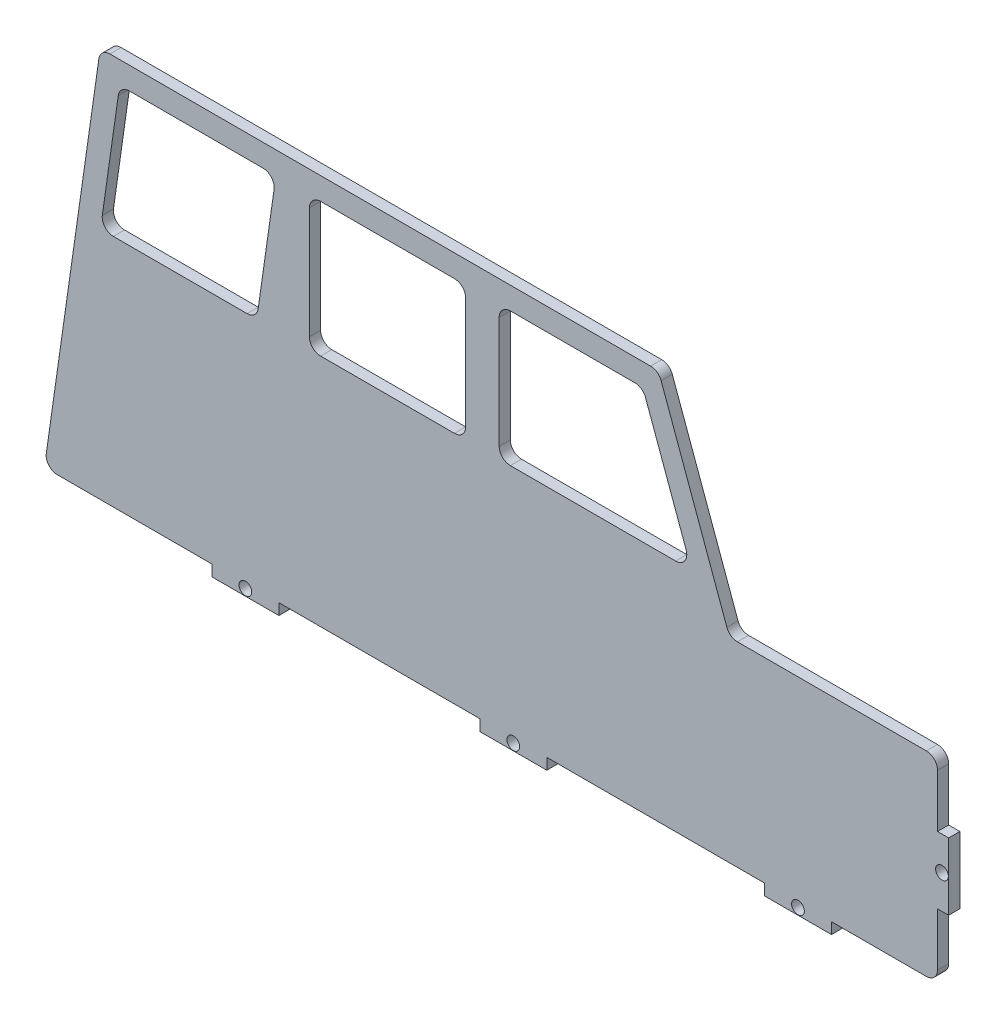
from build123d import *

# Parameters (mm, degrees)
BOSS_EXTRUDE1_DEPTH = 2.54
CUT_EXTRUDE1_REACH  = 139.823
SKETCH2_W           = 35.56
SKETCH2_H           = 30.48
FILLET1_R           = 2.54
FILLET3_R           = 2.54
CUT_EXTRUDE2_REACH  = 139.823
SKETCH4_R           = 1.4478


with BuildPart() as part:
    # Sketch1 → Boss-Extrude1 (new body)
    with BuildSketch(Plane.XY):
        Polygon((-63.5, 44.45), (63.5, 44.45), (79.678476913, 0), (127, 0), (127, -14.605), (129.54, -14.605), (129.54, -29.845), (127, -29.845), (127, -44.45), (102.87, -44.45), (102.87, -46.99), (87.63, -46.99), (87.63, -44.45), (63.5, -44.45), (38.1, -44.45), (38.1, -46.99), (22.86, -46.99), (22.86, -44.45), (-22.86, -44.45), (-22.86, -46.99), (-38.1, -46.99), (-38.1, -44.45), (-63.5, -44.45), (-76.2, -44.45), align=None)
    extrude(amount=BOSS_EXTRUDE1_DEPTH)

    # Sketch2 → Cut-Extrude1 (cut, up to next)
    with BuildSketch(Plane.XY.offset(2.54), mode=Mode.PRIVATE) as cut_extrude1_sk1:
        Polygon((-59.094139359, 39.37), (-63.448425074, 8.89), (-27.888425074, 8.89), (-23.534139359, 39.37), align=None)
    cut_extrude1_tool1 = extrude(cut_extrude1_sk1.sketch, amount=-CUT_EXTRUDE1_REACH, mode=Mode.PRIVATE) & part.part
    # Sketch2 → Cut-Extrude1 (cut, up to next)
    with BuildSketch(Plane.XY.offset(2.54), mode=Mode.PRIVATE) as cut_extrude1_sk2:
        Polygon((27.265860641, 39.37), (27.265860641, 8.89), (71.036758446, 8.89), (59.942945706, 39.37), align=None)
    cut_extrude1_tool2 = extrude(cut_extrude1_sk2.sketch, amount=-CUT_EXTRUDE1_REACH, mode=Mode.PRIVATE) & part.part
    # Sketch2 → Cut-Extrude1 (cut, up to next)
    with BuildSketch(Plane.XY.offset(2.54), mode=Mode.PRIVATE) as cut_extrude1_sk3:
        with Locations((1.865860641, 24.13)):
            Rectangle(SKETCH2_W, SKETCH2_H)
    cut_extrude1_tool3 = extrude(cut_extrude1_sk3.sketch, amount=-CUT_EXTRUDE1_REACH, mode=Mode.PRIVATE) & part.part
    add(cut_extrude1_tool1.solids().sort_by_distance((-43.491282, 24.13, 2.54))[0], mode=Mode.SUBTRACT)
    add(cut_extrude1_tool2.solids().sort_by_distance((46.512014, 23.392812, 2.54))[0], mode=Mode.SUBTRACT)
    add(cut_extrude1_tool3.solids().sort_by_distance((1.865861, 24.13, 2.54))[0], mode=Mode.SUBTRACT)

    # Fillet1
    fillet1_edges = [part.edges().sort_by_distance(p)[0] for p in [
        (-15.914139359, 8.89, 1.27),
        (19.645860641, 8.89, 1.27),
        (19.645860641, 39.37, 1.27),
        (-15.914139359, 39.37, 1.27),
        (27.265860641, 8.89, 1.27),
        (27.265860641, 39.37, 1.27),
        (-27.888425074, 8.89, 1.27),
        (-23.534139359, 39.37, 1.27),
        (-63.448425074, 8.89, 1.27),
        (-59.094139359, 39.37, 1.27),
        (71.036758446, 8.89, 1.27),
        (59.942945706, 39.37, 1.27),
    ]]
    fillet(fillet1_edges, radius=FILLET1_R)

    # Fillet3
    fillet3_edges = [part.edges().sort_by_distance(p)[0] for p in [
        (79.678476913, 0, 1.27),
        (63.5, 44.45, 1.27),
        (-63.5, 44.45, 1.27),
        (-76.2, -44.45, 1.27),
        (127, -44.45, 1.27),
        (127, 0, 1.27),
    ]]
    fillet(fillet3_edges, radius=FILLET3_R)

    # Sketch4 → Cut-Extrude2 (cut, up to next)
    with BuildSketch(Plane.XY.offset(2.54), mode=Mode.PRIVATE) as cut_extrude2_sk1:
        with Locations((95.25, -45.466)):
            Circle(SKETCH4_R)
    cut_extrude2_tool1 = extrude(cut_extrude2_sk1.sketch, amount=-CUT_EXTRUDE2_REACH, mode=Mode.PRIVATE) & part.part
    # Sketch4 → Cut-Extrude2 (cut, up to next)
    with BuildSketch(Plane.XY.offset(2.54), mode=Mode.PRIVATE) as cut_extrude2_sk2:
        with Locations((30.48, -45.466)):
            Circle(SKETCH4_R)
    cut_extrude2_tool2 = extrude(cut_extrude2_sk2.sketch, amount=-CUT_EXTRUDE2_REACH, mode=Mode.PRIVATE) & part.part
    # Sketch4 → Cut-Extrude2 (cut, up to next)
    with BuildSketch(Plane.XY.offset(2.54), mode=Mode.PRIVATE) as cut_extrude2_sk3:
        with Locations((-30.48, -45.466)):
            Circle(SKETCH4_R)
    cut_extrude2_tool3 = extrude(cut_extrude2_sk3.sketch, amount=-CUT_EXTRUDE2_REACH, mode=Mode.PRIVATE) & part.part
    # Sketch4 → Cut-Extrude2 (cut, up to next)
    with BuildSketch(Plane.XY.offset(2.54), mode=Mode.PRIVATE) as cut_extrude2_sk4:
        with Locations((128.016, -22.225)):
            Circle(SKETCH4_R)
    cut_extrude2_tool4 = extrude(cut_extrude2_sk4.sketch, amount=-CUT_EXTRUDE2_REACH, mode=Mode.PRIVATE) & part.part
    add(cut_extrude2_tool1.solids().sort_by_distance((95.25, -45.466, 2.54))[0], mode=Mode.SUBTRACT)
    add(cut_extrude2_tool2.solids().sort_by_distance((30.48, -45.466, 2.54))[0], mode=Mode.SUBTRACT)
    add(cut_extrude2_tool3.solids().sort_by_distance((-30.48, -45.466, 2.54))[0], mode=Mode.SUBTRACT)
    add(cut_extrude2_tool4.solids().sort_by_distance((128.016, -22.225, 2.54))[0], mode=Mode.SUBTRACT)


solid = part.part
